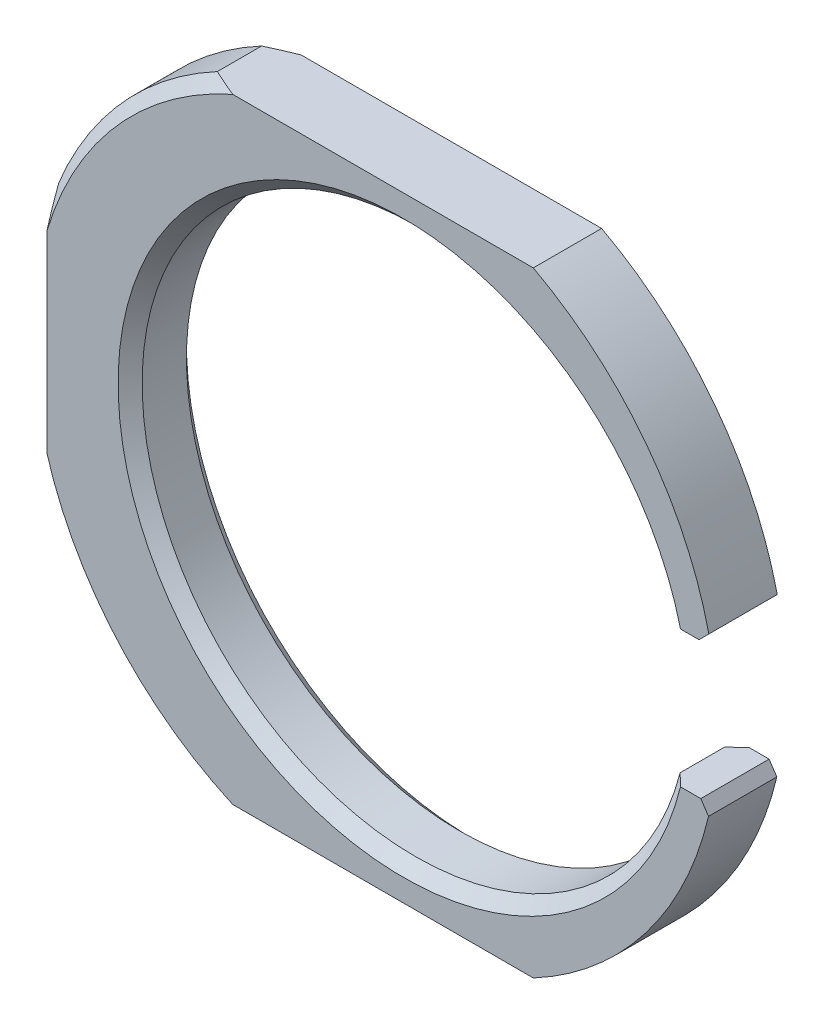
from build123d import *

# Parameters (mm, degrees)
BOSS_EXTRUDE1_DEPTH = 3.175
CHAMFER1_SIZE       = 0.5588
CHAMFER2_SIZE       = 0.5588
CHAMFER2_SIZE_2     = 0.474900858


with BuildPart() as part:
    # Sketch1 → Boss-Extrude1 (new body)
    with BuildSketch(Plane.XY):
        with BuildLine():
            Line((13.884222124, 3.175), (15.878174683, 3.175))
            ThreePointArc((15.878174683, 3.175), (12.996652162, 9.65836885), (7.62, 14.2875))
            Line((7.62, 14.2875), (-7.62, 14.2875))
            ThreePointArc((-7.62, 14.2875), (-12.015852965, 10.854323276), (-14.986, 6.133258534))
            Line((-14.986, 6.133258534), (-14.986, -6.133258534))
            ThreePointArc((-14.986, -6.133258534), (-12.015852965, -10.854323276), (-7.62, -14.2875))
            Line((-7.62, -14.2875), (7.62, -14.2875))
            ThreePointArc((7.62, -14.2875), (12.996652162, -9.65836885), (15.878174683, -3.175))
            Line((15.878174683, -3.175), (13.884222124, -3.175))
            ThreePointArc((13.884222124, -3.175), (-11.1125, 0), (13.884222124, 3.175))
        make_face()
    extrude(amount=BOSS_EXTRUDE1_DEPTH)

    # Chamfer1
    chamfer1_edges = [part.edges().sort_by_distance(p)[0] for p in [
        (-11.1125, 0, 0),
        (-12.015852965, -10.854323276, 0),
        (-12.015852965, 10.854323276, 0),
        (-12.015852965, -10.854323276, 3.175),
        (-11.1125, 0, 3.175),
        (-12.015852965, 10.854323276, 3.175),
    ]]
    chamfer(chamfer1_edges, length=CHAMFER1_SIZE)

    # Chamfer2
    # the kernel refuses this chamfer: 0.5588, 0.474900858 mm, written as the material it takes off along each edge
    with BuildSketch(Plane(origin=(15.878174683, 3.175, -1.437056454), x_dir=(-1, 0, 0), z_dir=(0, 0, 1))) as chamfer2_piece_1:
        with BuildLine():
            Line((CHAMFER2_SIZE, 0), (0.098924499, -0.459875501))
            ThreePointArc((0.098924499, -0.459875501), (0.04906799, -0.236222299), (0, 0))
            Line((0, 0), (CHAMFER2_SIZE, 0))
        make_face()
    extrude(amount=6.049112907, mode=Mode.SUBTRACT)
    with BuildSketch(Plane(origin=(15.878174683, -3.175, -1.413292003), x_dir=(-1, 0, 0), z_dir=(0, 0, 1))) as chamfer2_piece_2:
        with BuildLine():
            Line((CHAMFER2_SIZE_2, 0), (0.116884641, 0.536979589))
            ThreePointArc((0.116884641, 0.536979589), (0.057817387, 0.276572291), (0, 0))
            Line((0, 0), (CHAMFER2_SIZE_2, 0))
        make_face()
    extrude(amount=6.001584006, mode=Mode.SUBTRACT)


solid = part.part
